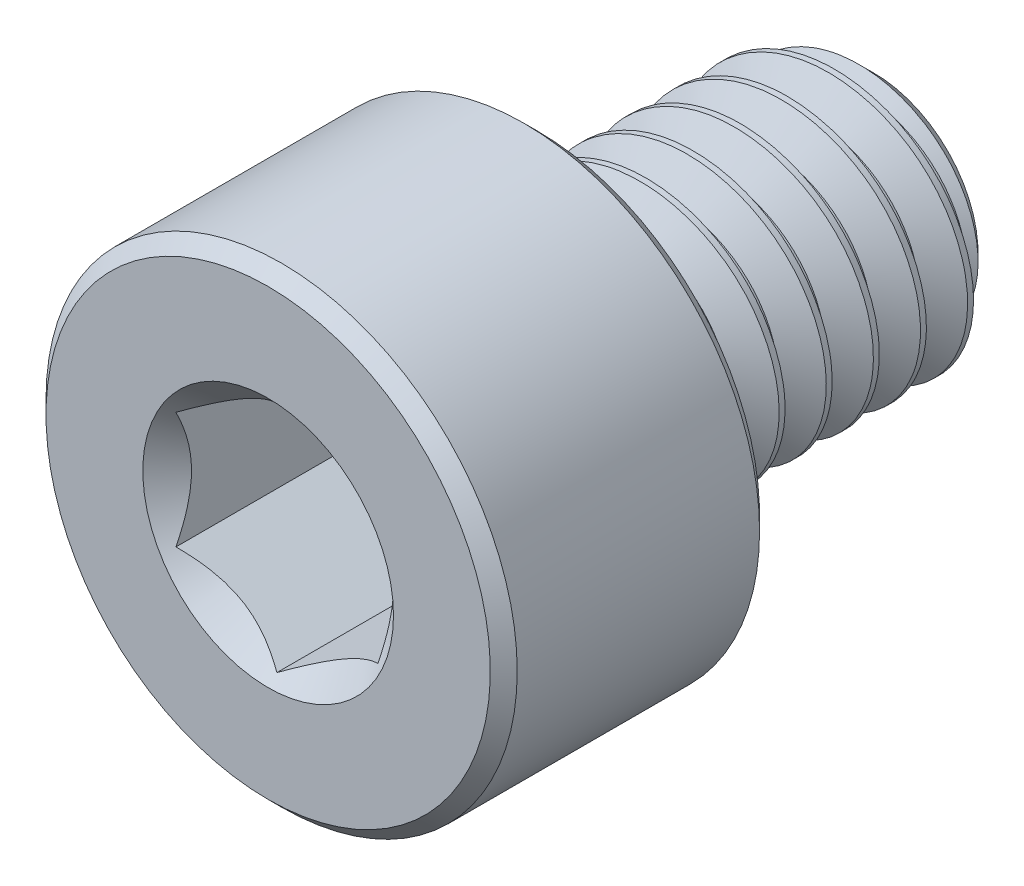
from build123d import *

# Parameters (mm, degrees)
CUT_EXTRUDE1_DEPTH     = 3
SPLIT1_SURFACE_1_BACK  = 14.379
SPLIT1_SURFACE_1_DEPTH = 28.758
SPLIT1_SURFACE_2_BACK  = 14.379
SPLIT1_SURFACE_2_DEPTH = 28.758
CUT_SWEEP1_PITCH       = 0.7


with BuildPart() as part:
    # Sketch2 → Revolve1 (revolve)
    with BuildSketch(Plane(origin=(0, 0, 0), x_dir=(0, 0, -1), z_dir=(1, 0, 0))):
        with BuildLine():
            Line((-4.5, 0), (-4.5, 3.3))
            Line((-4.5, 3.3), (-4.3, 3.5))
            Line((-4.3, 3.5), (-0.7, 3.5))
            Line((-0.7, 3.5), (-0.5, 3.3))
            Line((-0.5, 3.3), (-0.5, 2.2))
            ThreePointArc((-0.5, 2.2), (-0.441421356, 2.058578644), (-0.3, 2))
            Line((-0.3, 2), (4.045336663, 2))
            Line((4.045336663, 2), (4.5, 1.545336663))
            Line((4.5, 1.545336663), (4.5, 0))
            Line((4.5, 0), (-4.5, 0))
        make_face()
    revolve(axis=Axis((0, 0, -4.5), (0, 0, 1)))

    # Sketch3 → Cut-Extrude1 (cut)
    with BuildSketch(Plane.XY.offset(4.5)):
        Polygon((1.5, -0.866025404), (1.5, 0.866025404), (0, 1.732050808), (-1.5, 0.866025404), (-1.5, -0.866025404), (0, -1.732050808), align=None)
    extrude(amount=-CUT_EXTRUDE1_DEPTH, mode=Mode.SUBTRACT)

    # Cut-Extrude2 cone 1 section (through the dimple's axis) → Cut-Extrude2 (revolve, cut)
    with BuildSketch(Plane(origin=(0, 0, 4.5), x_dir=(0, -1, 0), z_dir=(1, 0, 0))):
        Polygon((0, 0), (1.861954618, 0), (0, 1.861954618), align=None)
    revolve(axis=Axis((0, 0, 4.5), (0, 0, -1)), mode=Mode.SUBTRACT)


with BuildPart() as body_2:
    # Split1: the piece behind the surface
    add(part.part)
    # Split1 surface: a surface, the sketch's curves swept straight by 28.758 mm
    with BuildLine(Plane(origin=(0, 0, 0), x_dir=(0, 0, -1), z_dir=(1, 0, 0)).offset(-SPLIT1_SURFACE_1_BACK), mode=Mode.PRIVATE) as split1_surface_1_path:
        Line((-0.3, -3.5), (-0.3, 3.5))
    split1_surface_1 = Shell.extrude(split1_surface_1_path.wire(), (1 * SPLIT1_SURFACE_1_DEPTH, 0 * SPLIT1_SURFACE_1_DEPTH, 0 * SPLIT1_SURFACE_1_DEPTH))
    split(bisect_by=split1_surface_1, keep=Keep.BOTTOM)

    # Cut-Sweep1: the profile of Sketch7 screwed along a right-hand helix of 8.142857 turns, 6 arcs to a turn; built about Z, then put on its axis
    cut_sweep1_z = Axis((0, 0, 0), (0, 0, 1))
    cut_sweep1_corners = [(2.037888611, 0, 0.021875), (2.037888611, 0, -0.634375), (1.545336663, 0, -0.35), (1.545336663, 0, -0.2625)]
    with BuildLine(mode=Mode.PRIVATE) as cut_sweep1_profile:
        Line(cut_sweep1_corners[0], cut_sweep1_corners[1])
        Line(cut_sweep1_corners[1], cut_sweep1_corners[2])
        Line(cut_sweep1_corners[2], cut_sweep1_corners[3])
        Line(cut_sweep1_corners[3], cut_sweep1_corners[0])
    cut_sweep1_cap = Face(cut_sweep1_profile.wire())
    cut_sweep1_turn_angles = [0, 30, 60, 90, 120, 150, 180, 210, 240, 270, 300, 330, 360]
    cut_sweep1_turn_weights = [1, 0.8660254037844387, 1, 0.8660254037844387, 1, 0.8660254037844387, 1, 0.8660254037844387, 1, 0.8660254037844387, 1, 0.8660254037844387, 1]
    cut_sweep1_turn_rails = [Edge.make_bspline([Vector(p[0], p[1], 0).rotate(cut_sweep1_z, cut_sweep1_turn_angles[k]) / cut_sweep1_turn_weights[k] + Vector(0, 0, p[2] + CUT_SWEEP1_PITCH * cut_sweep1_turn_angles[k] / 360) for k in range(13)], [0, 0, 0, 1, 1, 2, 2, 3, 3, 4, 4, 5, 5, 6, 6, 6], 2, cut_sweep1_turn_weights) for p in cut_sweep1_corners]
    cut_sweep1_turn_sides = [Face.make_surface_from_curves(cut_sweep1_turn_rails[p[0]], cut_sweep1_turn_rails[p[1]]) for p in [(0, 1), (1, 2), (2, 3), (3, 0)]]
    cut_sweep1_turn = Solid(Shell([*cut_sweep1_turn_sides, cut_sweep1_cap, cut_sweep1_cap.rotate(cut_sweep1_z, 360).moved(Location((0, 0, CUT_SWEEP1_PITCH * 360 / 360)))]))
    cut_sweep1_last_angles = [2880, 2905.714285714, 2931.428571429]
    cut_sweep1_last_weights = [1, 0.9009688679023722, 1]
    cut_sweep1_last_rails = [Edge.make_bspline([Vector(p[0], p[1], 0).rotate(cut_sweep1_z, cut_sweep1_last_angles[k]) / cut_sweep1_last_weights[k] + Vector(0, 0, p[2] + CUT_SWEEP1_PITCH * cut_sweep1_last_angles[k] / 360) for k in range(3)], [0, 0, 0, 1, 1, 1], 2, cut_sweep1_last_weights) for p in cut_sweep1_corners]
    cut_sweep1_last_sides = [Face.make_surface_from_curves(cut_sweep1_last_rails[p[0]], cut_sweep1_last_rails[p[1]]) for p in [(0, 1), (1, 2), (2, 3), (3, 0)]]
    cut_sweep1_last = Solid(Shell([*cut_sweep1_last_sides, cut_sweep1_cap.rotate(cut_sweep1_z, 2880).moved(Location((0, 0, CUT_SWEEP1_PITCH * 2880 / 360))), cut_sweep1_cap.rotate(cut_sweep1_z, 2931.428571429).moved(Location((0, 0, CUT_SWEEP1_PITCH * 2931.428571429 / 360)))]))
    cut_sweep1_each = [*[cut_sweep1_turn.moved(Location((0, 0, CUT_SWEEP1_PITCH * i))) for i in range(8)], cut_sweep1_last]
    add(Plane(origin=(0, 0, -4.5), x_dir=(0, 1, 0), z_dir=(0, 0, 1)) * Compound([cut_sweep1_each[i] for i in range(0, 9, 2)]), mode=Mode.SUBTRACT)
    add(Plane(origin=(0, 0, -4.5), x_dir=(0, 1, 0), z_dir=(0, 0, 1)) * Compound([cut_sweep1_each[i] for i in range(1, 9, 2)]), mode=Mode.SUBTRACT)


with BuildPart() as part_1:
    add(part.part)

    # Split1: split by a surface, the side it looks to stays
    # Split1 surface: a surface, the sketch's curves swept straight by 28.758 mm
    with BuildLine(Plane(origin=(0, 0, 0), x_dir=(0, 0, -1), z_dir=(1, 0, 0)).offset(-SPLIT1_SURFACE_2_BACK), mode=Mode.PRIVATE) as split1_surface_2_path:
        Line((-0.3, -3.5), (-0.3, 3.5))
    split1_surface_2 = Shell.extrude(split1_surface_2_path.wire(), (1 * SPLIT1_SURFACE_2_DEPTH, 0 * SPLIT1_SURFACE_2_DEPTH, 0 * SPLIT1_SURFACE_2_DEPTH))
    split(bisect_by=split1_surface_2, keep=Keep.TOP)

    add(body_2.part)  # Revolve2 merges body 2
    # Sketch8 → Revolve2 (revolve)
    with BuildSketch(Plane(origin=(0, 0, 0), x_dir=(0, 0, -1), z_dir=(1, 0, 0)), mode=Mode.PRIVATE) as revolve2_sk:
        Polygon((-0.5, 0), (-0.5, 2), (-0.3, 2), (0.854700538, 0), align=None)
    revolve(revolve2_sk.sketch.rotate(Axis((0, 0, -0.854700538), (0, 0, 1)), 270), axis=Axis((0, 0, -0.854700538), (0, 0, 1)))


solid = part_1.part
